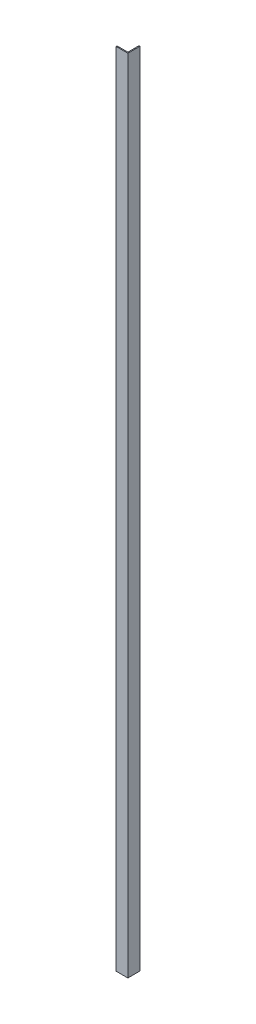
from build123d import *

# Parameters (mm, degrees)
BOSS_EXTRUDE1_DEPTH = 1220
FILLET1_R           = 1
FILLET2_SIZE        = 2
FILLET2_SIZE_2      = 1.2
FILLET3_SIZE        = 1.2
FILLET3_SIZE_2      = 2


with BuildPart() as part:
    # Sketch1 → Boss-Extrude1 (new body)
    with BuildSketch(Plane(origin=(0, 0, 0), x_dir=(1, 0, 0), z_dir=(0, 1, 0))):
        Polygon((0, 0), (18, 0), (18, 18.421241087), (16.5, 18.421241087), (16.5, 1.5), (0, 1.5), align=None)
    extrude(amount=BOSS_EXTRUDE1_DEPTH)

    # Fillet1
    fillet1_edges = [part.edges().sort_by_distance(p)[0] for p in [
        (16.5, 610, -1.5),
    ]]
    fillet(fillet1_edges, radius=FILLET1_R)

    # Fillet2
    # an asymmetric fillet: 2, 1.2 mm, written as the material it takes off along each edge
    with BuildSketch(Plane(origin=(16.5, -5, -18.421241087), x_dir=(0, 0, 1), z_dir=(0, 1, 0))) as fillet2_piece_1:
        with BuildLine():
            Bezier((FILLET2_SIZE, 0), (0, 0), (0, FILLET2_SIZE_2), weights=[1, 0.707106781, 1])
            Line((0, FILLET2_SIZE_2), (0, 0))
            Line((0, 0), (FILLET2_SIZE, 0))
        make_face()
    extrude(amount=1230, mode=Mode.SUBTRACT)

    # Fillet3
    # an asymmetric fillet: 2, 1.2 mm, written as the material it takes off along each edge
    with BuildSketch(Plane(origin=(0, -5, -1.5), x_dir=(0, 0, 1), z_dir=(0, 1, 0))) as fillet3_piece_1:
        with BuildLine():
            Bezier((FILLET3_SIZE, 0), (0, 0), (0, FILLET3_SIZE_2), weights=[1, 0.707106781, 1])
            Line((0, FILLET3_SIZE_2), (0, 0))
            Line((0, 0), (FILLET3_SIZE, 0))
        make_face()
    extrude(amount=1230, mode=Mode.SUBTRACT)


solid = part.part
